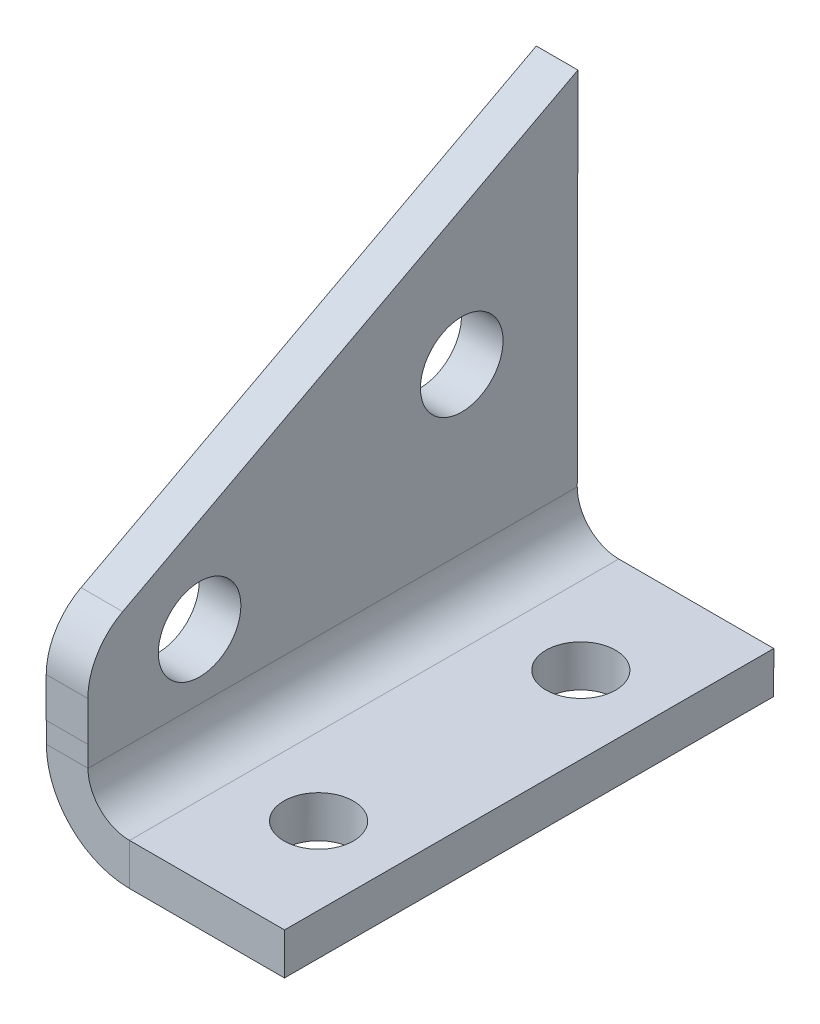
from build123d import *

# Parameters (mm, degrees)
BASE_FLANGE1_DEPTH            = 3.175
EDGE_FLANGE1_STRIP_W          = 19.05
EDGE_FLANGE1_STRIP_H          = 3.175
EDGE_FLANGE1_STRIP_CUT_DEPTH  = 37.325997284
EDGE_FLANGE1_RELIEF_W         = 20.6375
EDGE_FLANGE1_RELIEF_H         = 1.5875
EDGE_FLANGE1_RELIEF_CUT_DEPTH = 3.175
EDGE_FLANGE1_DEPTH            = 37.325997284
SKETCH15_R                    = 2.65
CUT_EXTRUDE2_DEPTH            = 10
SKETCH19_R                    = 3.15
CUT_EXTRUDE4_DEPTH            = 10


# Sheet-metal steps are written as plain solids
with BuildPart() as part:
    # Sketch3 → Base-Flange1 (new body)
    with BuildSketch(Plane(origin=(0, 0, 0), x_dir=(0, 0, -1), z_dir=(1, 0, 0))):
        with BuildLine():
            Line((83.106142408, 32.105064535), (45.780209905, 32.174606262))
            Line((45.780209905, 32.174606262), (45.780209905, 43.136168925))
            ThreePointArc((45.780209905, 43.136168925), (46.495831721, 45.713784796), (48.437851335, 47.553561406))
            Line((48.437851335, 47.553561406), (83.169236275, 65.970162941))
            Line((83.169236275, 65.970162941), (83.106142408, 32.105064535))
        make_face()
    extrude(amount=-BASE_FLANGE1_DEPTH)

    # Edge-Flange1 strip (across the edge) → Edge-Flange1 strip cut (cut)
    with BuildSketch(Plane(origin=(0, 32.174606262, -45.780209905), x_dir=(3.4914813388431334e-15, 0.999998264444559, -0.001863090945206598), z_dir=(0, -0.001863090945206598, -0.999998264444559))):
        with Locations((-3.175, -1.5875)):
            Rectangle(EDGE_FLANGE1_STRIP_W, EDGE_FLANGE1_STRIP_H)
    extrude(amount=EDGE_FLANGE1_STRIP_CUT_DEPTH, mode=Mode.SUBTRACT)

    # Edge-Flange1 relief (on the sheet) → Edge-Flange1 relief cut (cut)
    with BuildSketch(Plane(origin=(0, 38.524595242, -45.792040532), x_dir=(6.982962677686267e-15, 0.999998264444559, -0.001863090945206598), z_dir=(1, 0, 0))):
        with Locations((-8.73125, 0.79375)):
            Rectangle(EDGE_FLANGE1_RELIEF_W, EDGE_FLANGE1_RELIEF_H)
    extrude(amount=-EDGE_FLANGE1_RELIEF_CUT_DEPTH, mode=Mode.SUBTRACT)

    # Edge-Flange1 section (across the edge) → Edge-Flange1 (add)
    with BuildSketch(Plane(origin=(0, 32.174606262, -45.780209905), x_dir=(3.4914813388431334e-15, 0.999998264444559, -0.001863090945206598), z_dir=(0, -0.001863090945206598, -0.999998264444559))):
        with BuildLine():
            Line((0, 3.175), (0, 15))
            Line((0, 15), (3.175, 15))
            Line((3.175, 15), (3.175, 3.175))
            ThreePointArc((3.175, 3.175), (4.10493597, 0.92993597), (6.35, 0))
            Line((6.35, 0), (6.35, -3.175))
            ThreePointArc((6.35, -3.175), (1.859871939, -1.315128061), (0, 3.175))
        make_face()
    extrude(amount=EDGE_FLANGE1_DEPTH)

    # Sketch15 → Cut-Extrude2 (cut)
    with BuildSketch(Plane(origin=(0, 35.434781617, -0.066018335), x_dir=(1, 0, 0), z_dir=(-3.23986857388729e-15, 0.999998264444559, -0.0018630909452065992))):
        with Locations(Location((9.0875, 74.237769892, 0), (0, 0, 270))):
            Circle(SKETCH15_R)
        with Locations(Location((9.0875, 54.233380341, 0), (0, 0, 270))):
            Circle(SKETCH15_R)
    extrude(amount=-CUT_EXTRUDE2_DEPTH, mode=Mode.SUBTRACT)

    # Sketch19 → Cut-Extrude4 (cut)
    with BuildSketch(Plane.ZY.offset(3.175)):
        with Locations((-54.306440614, 43.455053514)):
            Circle(SKETCH19_R)
        with Locations((-74.30640548, 50.955053514)):
            Circle(SKETCH19_R)
    extrude(amount=-CUT_EXTRUDE4_DEPTH, mode=Mode.SUBTRACT)


solid = part.part
